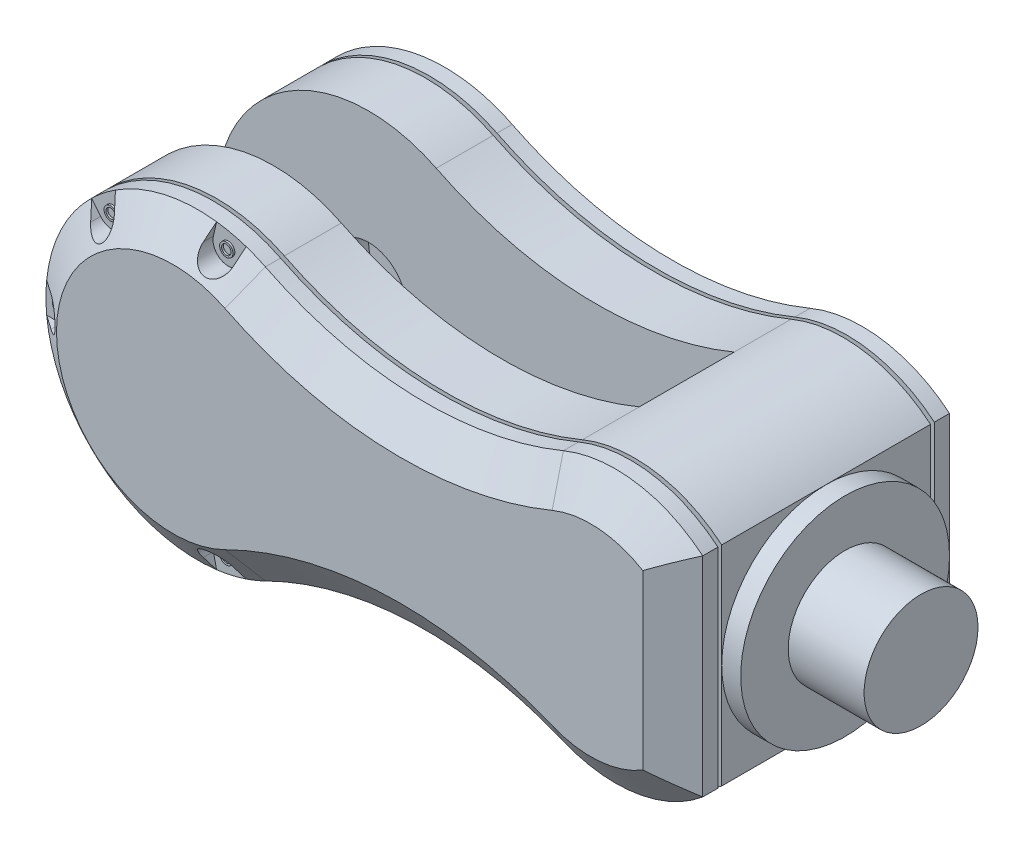
from build123d import *

# Parameters (mm, degrees)
SKETCH1_R           = 27.5
BOSS_EXTRUDE1_DEPTH = 5
BOSS_EXTRUDE2_DEPTH = 15
BOSS_EXTRUDE3_DEPTH = 1
BOSS_EXTRUDE4_START = 4
BOSS_EXTRUDE4_DEPTH = 4
BOSS_EXTRUDE5_DEPTH = 6.5
BOSS_EXTRUDE5_DRAFT = 55
CUT_EXTRUDE1_DEPTH  = 6.5
SKETCH7_R           = 1.75
SKETCH7_R_2         = 1.25
BOSS_EXTRUDE6_DEPTH = 0.5
CIRPATTERN1_COUNT   = 7
BOSS_EXTRUDE7_DEPTH = 40
SKETCH10_R          = 10
CUT_EXTRUDE2_DEPTH  = 10
SKETCH9_R           = 15
BOSS_EXTRUDE8_DEPTH = 20


# Read off the part's stored shape, not the designer's step: Mirror1
with BuildPart() as part:
    # Sketch1 → Boss-Extrude1 (new body)
    with BuildSketch(Plane(origin=(0, 0, 0), x_dir=(0, 0, -1), z_dir=(1, 0, 0))):
        Circle(SKETCH1_R)
    extrude(amount=BOSS_EXTRUDE1_DEPTH)

    # Sketch2 → Boss-Extrude2 (add)
    with BuildSketch(Plane.XY.offset(-27.5)):
        with BuildLine():
            Line((0, 27.5), (0, -27.5))
            ThreePointArc((0, -27.5), (-17.571618914, -35.437024124), (-36.713395286, -33.123900581))
            ThreePointArc((-36.713395286, -33.123900581), (-76.248280636, -25.967043477), (-115.198705437, -35.820579446))
            ThreePointArc((-115.198705437, -35.820579446), (-173, 0), (-115.198705437, 35.820579446))
            ThreePointArc((-115.198705437, 35.820579446), (-76.248280636, 25.967043477), (-36.713395286, 33.123900581))
            ThreePointArc((-36.713395286, 33.123900581), (-17.571618914, 35.437024124), (0, 27.5))
        make_face()
    extrude(amount=BOSS_EXTRUDE2_DEPTH)

    # Sketch3 → Boss-Extrude3 (add)
    with BuildSketch(Plane(origin=(0, 0, -27.5), x_dir=(-1, 0, 0), z_dir=(0, 0, -1))):
        with BuildLine():
            Line((2.5, 26.305856426), (2.5, 0))
            Line((2.5, 0), (2.5, -26.305856426))
            ThreePointArc((2.5, -26.305856426), (18.520153457, -33.048132432), (35.757101801, -30.814029856))
            ThreePointArc((35.757101801, -30.814029856), (76.334127545, -23.46851785), (116.311286347, -33.581793231))
            ThreePointArc((116.311286347, -33.581793231), (170.5, 0), (116.311286347, 33.581793231))
            ThreePointArc((116.311286347, 33.581793231), (76.334127545, 23.46851785), (35.757101801, 30.814029856))
            ThreePointArc((35.757101801, 30.814029856), (18.520153457, 33.048132432), (2.5, 26.305856426))
        make_face()
    extrude(amount=BOSS_EXTRUDE3_DEPTH)

    # Sketch4 → Boss-Extrude4 (add)
    with BuildSketch(Plane(origin=(0, 0, -28.5), x_dir=(-1, 0, 0), z_dir=(0, 0, -1)).offset(BOSS_EXTRUDE4_START)):
        with BuildLine():
            Line((0, 27.5), (0, 0))
            Line((0, 0), (0, -27.5))
            ThreePointArc((0, -27.5), (17.571618914, -35.437024124), (36.713395286, -33.123900581))
            ThreePointArc((36.713395286, -33.123900581), (76.248280636, -25.967043477), (115.198705437, -35.820579446))
            ThreePointArc((115.198705437, -35.820579446), (173, 0), (115.198705437, 35.820579446))
            ThreePointArc((115.198705437, 35.820579446), (76.248280636, 25.967043477), (36.713395286, 33.123900581))
            ThreePointArc((36.713395286, 33.123900581), (17.571618914, 35.437024124), (0, 27.5))
        make_face()
    extrude(amount=-BOSS_EXTRUDE4_DEPTH)


with BuildPart() as boss_extrude5_tool:
    # Sketch5 → Boss-Extrude5 (with draft: the straight prism first)
    with BuildSketch(Plane(origin=(0, 0, -32.5), x_dir=(-1, 0, 0), z_dir=(0, 0, -1))):
        with BuildLine():
            Line((0, 27.5), (0, -27.5))
            ThreePointArc((0, -27.5), (17.571618914, -35.437024124), (36.713395286, -33.123900581))
            ThreePointArc((36.713395286, -33.123900581), (76.248280636, -25.967043477), (115.198705437, -35.820579446))
            ThreePointArc((115.198705437, -35.820579446), (173, 0), (115.198705437, 35.820579446))
            ThreePointArc((115.198705437, 35.820579446), (76.248280636, 25.967043477), (36.713395286, 33.123900581))
            ThreePointArc((36.713395286, 33.123900581), (17.571618914, 35.437024124), (0, 27.5))
        make_face()
    extrude(amount=BOSS_EXTRUDE5_DEPTH)
    # Boss-Extrude5: the draft: its side faces are tilted about the plane it starts from
    boss_extrude5_sides = [boss_extrude5_tool.faces().sort_by_distance(p)[0] for p in [
        (-17.571618914, 35.437024124, -35.75),
        (0, 0, -35.75),
        (-17.571618914, -35.437024124, -35.75),
        (-76.248280636, -25.967043477, -35.75),
        (-173, 0, -35.75),
        (-76.248280636, 25.967043477, -35.75),
    ]]
    draft(boss_extrude5_sides, Plane(origin=(0, 0, -32.5), x_dir=(-1, 0, 0), z_dir=(0, 0, -1)), BOSS_EXTRUDE5_DRAFT)


with BuildPart() as part_1:
    add(part.part)

    # Boss-Extrude5: add boss_extrude5_tool
    add(boss_extrude5_tool.part)

    # Sketch6 → Cut-Extrude1 (cut)
    with BuildSketch(Plane(origin=(0, 0, -39), x_dir=(-1, 0, 0), z_dir=(0, 0, -1))):
        with BuildLine():
            Line((169, 4), (175.46294633, 4))
            Line((175.46294633, 4), (175.46294633, -4))
            Line((175.46294633, -4), (169, -4))
            ThreePointArc((169, -4), (165, 0), (169, 4))
        make_face()
    cut_extrude1 = extrude(amount=-CUT_EXTRUDE1_DEPTH, mode=Mode.SUBTRACT)

    # Sketch7 → Boss-Extrude6 (add)
    with BuildSketch(Plane(origin=(0, 0, -32.5), x_dir=(-1, 0, 0), z_dir=(0, 0, -1))):
        with Locations((169, 0)):
            Circle(SKETCH7_R)
        with Locations((169, 0)):
            Circle(SKETCH7_R_2, mode=Mode.SUBTRACT)
    boss_extrude6 = extrude(amount=BOSS_EXTRUDE6_DEPTH)

    # CirPattern1: Cut-Extrude1, Boss-Extrude6 ×7 about axis, 2 skipped
    cirpattern1_axis = Axis((-133, 0, 0), (0, 0, -1))
    add([cut_extrude1.rotate(cirpattern1_axis, i * 360 / CIRPATTERN1_COUNT) for i in range(1, CIRPATTERN1_COUNT) if i not in (3, 4)], mode=Mode.SUBTRACT)
    add([boss_extrude6.rotate(cirpattern1_axis, i * 360 / CIRPATTERN1_COUNT) for i in range(1, CIRPATTERN1_COUNT) if i not in (3, 4)])

    # Sketch8 → Boss-Extrude7 (add)
    with BuildSketch(Plane.XY.offset(-12.5)):
        with BuildLine():
            Line((-36.713395286, 33.123900581), (-36.713395286, -33.123900581))
            ThreePointArc((-36.713395286, -33.123900581), (-17.571618914, -35.437024124), (0, -27.5))
            Line((0, -27.5), (0, -24.494897428))
            Line((0, -24.494897428), (0, 24.494897428))
            Line((0, 24.494897428), (0, 27.5))
            ThreePointArc((0, 27.5), (-17.571618914, 35.437024124), (-36.713395286, 33.123900581))
        make_face()
    extrude(amount=BOSS_EXTRUDE7_DEPTH)

    # Sketch10 → Cut-Extrude2 (cut)
    with BuildSketch(Plane.XY.offset(-12.5)):
        with Locations((-133, 0)):
            Circle(SKETCH10_R)
    extrude(amount=-CUT_EXTRUDE2_DEPTH, mode=Mode.SUBTRACT)

    # Mirror1: part across plane


with BuildPart() as part_2:
    add(part_1.part)
    add(part_1.part.mirror(Plane.XY))

    # Sketch9 → Boss-Extrude8 (add)
    with BuildSketch(Plane(origin=(5, 0, 0), x_dir=(0, 0, -1), z_dir=(1, 0, 0))):
        Circle(SKETCH9_R)
    extrude(amount=BOSS_EXTRUDE8_DEPTH)


solid = part_2.part
